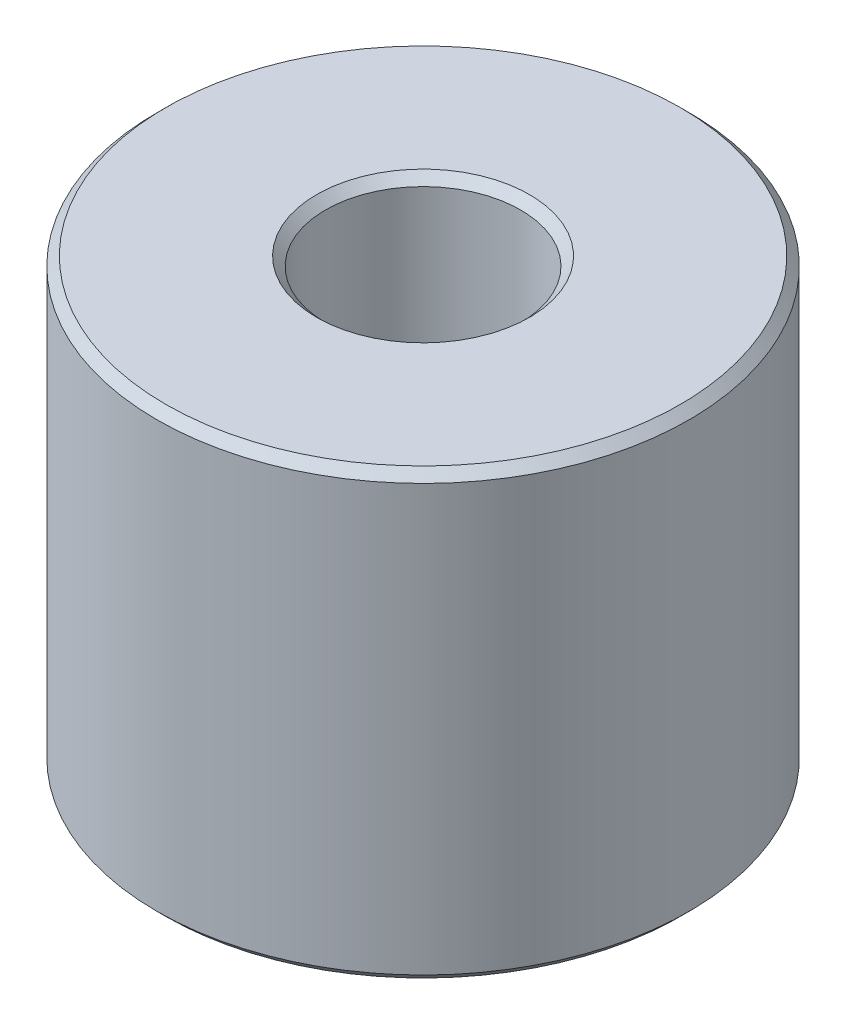
from build123d import *

# Parameters (mm, degrees)
SKETCH_1_R      = 3
SKETCH_1_R_2    = 1.1
EXTRUDE_1_DEPTH = 2.5
CHAMFER_1_SIZE  = 0.1


with BuildPart() as part:
    # ｽｹｯﾁ1 → ﾎﾞｽ - 押し出し1 (new, symmetric)
    with BuildSketch(Plane(origin=(0, 0, 0), x_dir=(1, 0, 0), z_dir=(0, 1, 0))):
        Circle(SKETCH_1_R)
        Circle(SKETCH_1_R_2, mode=Mode.SUBTRACT)
    extrude(amount=EXTRUDE_1_DEPTH, both=True)

    # 面取り1
    chamfer_1_edges = [part.edges().sort_by_distance(p)[0] for p in [
        (-3, -2.5, 0),
        (-3, 2.5, 0),
        (-1.1, -2.5, 0),
        (-1.1, 2.5, 0),
    ]]
    chamfer(chamfer_1_edges, length=CHAMFER_1_SIZE)


solid = part.part
